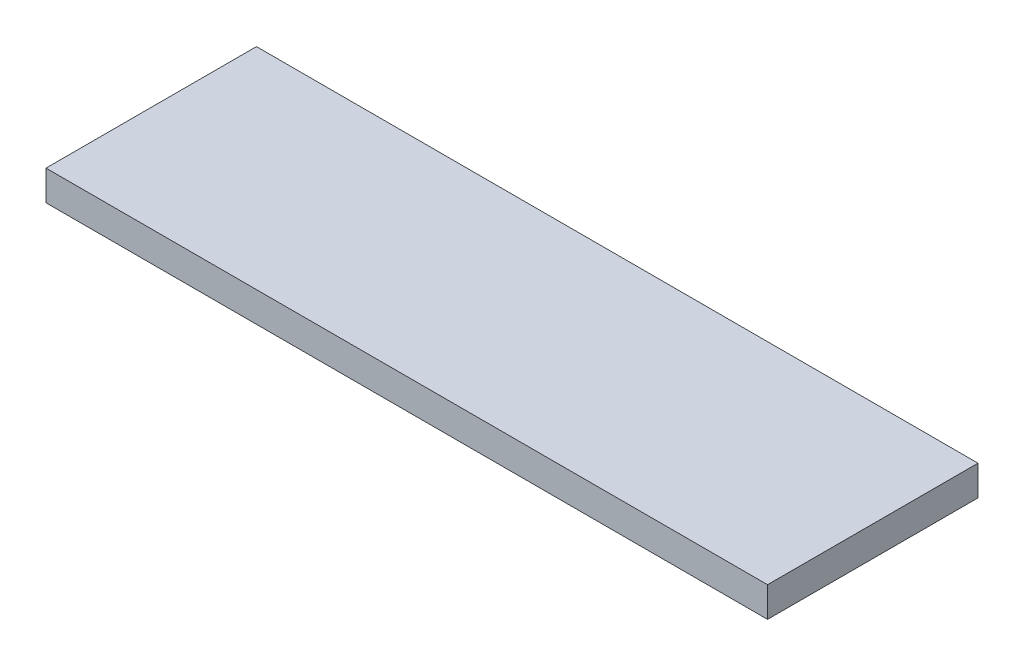
from build123d import *

# Parameters (mm, degrees)
SKETCH1_W           = 304.8
SKETCH1_H           = 88.9
BOSS_EXTRUDE1_DEPTH = 12.7


with BuildPart() as part:
    # Sketch1 → Boss-Extrude1 (new body)
    with BuildSketch(Plane(origin=(0, 0, 0), x_dir=(1, 0, 0), z_dir=(0, 1, 0))):
        with Locations((100.173455507, 27.053138705)):
            Rectangle(SKETCH1_W, SKETCH1_H)
    extrude(amount=BOSS_EXTRUDE1_DEPTH)


solid = part.part
